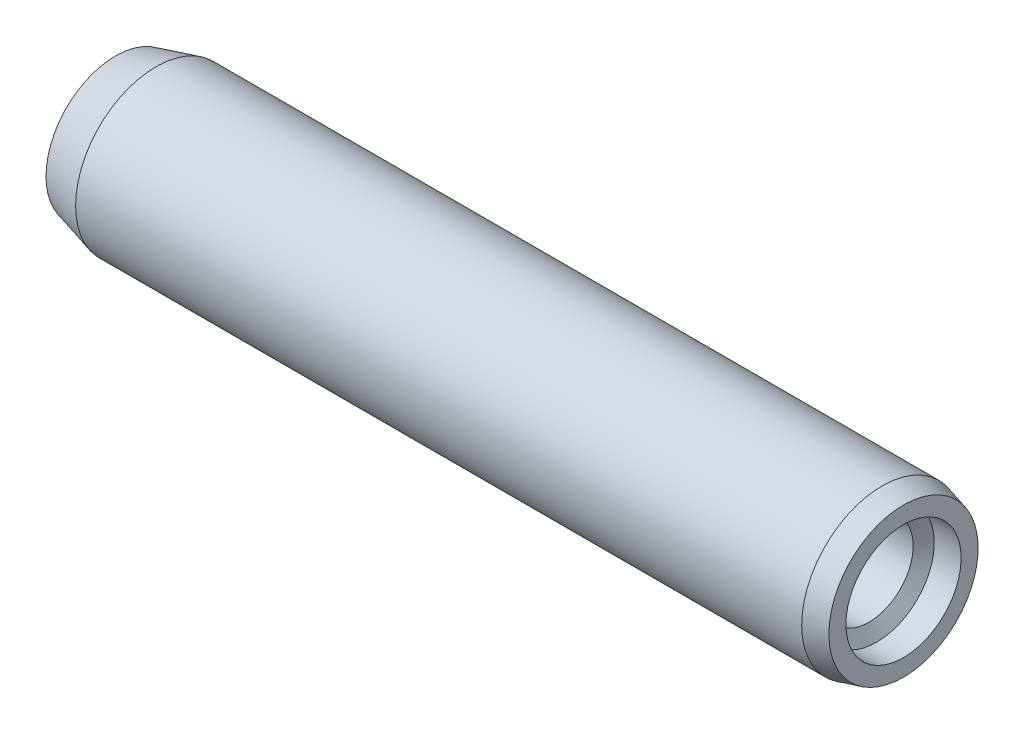
from build123d import *


with BuildPart() as part:
    # Sketch1 → Base-Revolve (revolve)
    with BuildSketch(Plane.XY):
        Polygon((0, 0), (0, 2.437306696), (2.1, 3), (29.2, 3), (30, 2.785640646), (30, 2.15), (29, 2.15), (28.711324865, 1.65), (20, 1.65), (19.008579979, 0), align=None)
    revolve(axis=Axis((-10, 0, 0), (1, 0, 0)))

    # Sketch2 → TypeA (revolve, cut)
    with BuildSketch(Plane.XY):
        with BuildLine():
            Line((0.590443768, 2.595515627), (0.590443768, 8))
            Line((0.590443768, 8), (-5, 8))
            Line((-5, 8), (-5, 0))
            Line((-5, 0), (0, 0))
            ThreePointArc((0, 0), (0.149472785, 1.33091371), (0.590443768, 2.595515627))
        make_face()
    revolve(axis=Axis((0, 0, 0), (1, 0, 0)), mode=Mode.SUBTRACT)


solid = part.part
